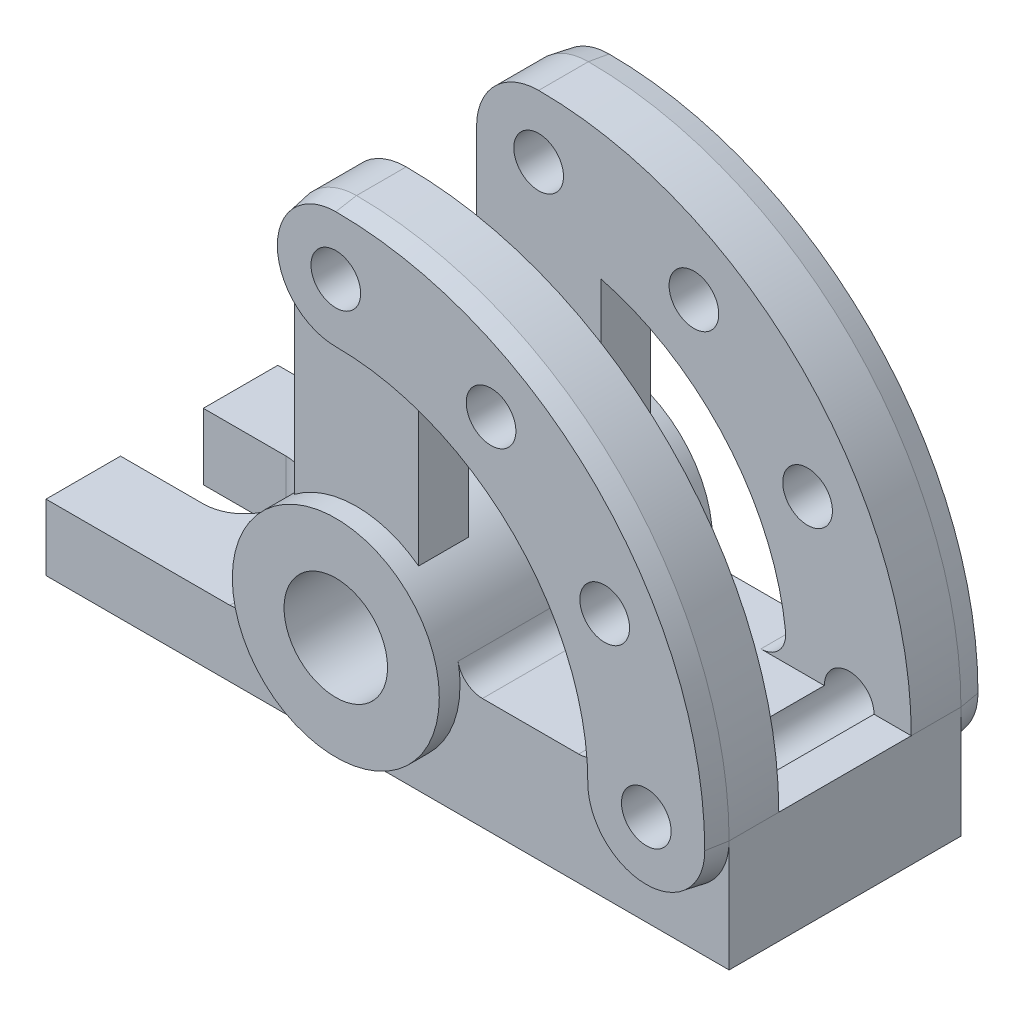
from build123d import *

# Parameters (mm, degrees)
SKETCH1_R                  = 25
BOSS_EXTRUDE1_DEPTH        = 33
CUT_EXTRUDE1_DEPTH         = 49.363209157
CUT_EXTRUDE1_DEPTH_BACK    = 49.363209157
SKETCH2_R                  = 12.5
BOSS_EXTRUDE2_START        = -28
BOSS_EXTRUDE2_DEPTH        = 5
BOSS_EXTRUDE2_DRAFT        = -10
BOSS_EXTRUDE3_START        = -16
BOSS_EXTRUDE3_DEPTH        = 12
BOSS_EXTRUDE5_START        = 28
BOSS_EXTRUDE5_DEPTH        = 5
BOSS_EXTRUDE5_TAPER        = 10
BOSS_EXTRUDE6_START        = 28
BOSS_EXTRUDE6_DEPTH        = 12
BOSS_EXTRUDE7_DEPTH        = 28
F_12_0_12_DIAMETER_HOLE1_D = 12
CIRPATTERN1_COUNT          = 4
CIRPATTERN1_ANGLE          = 90
CUT_EXTRUDE3_DEPTH         = 140.247980237
CUT_EXTRUDE3_DEPTH_BACK    = 56
FILLET1_R                  = 6


with BuildPart() as part:
    # Sketch1 → Boss-Extrude1 (new, symmetric)
    with BuildSketch(Plane.XY):
        Circle(SKETCH1_R)
    extrude(amount=BOSS_EXTRUDE1_DEPTH, both=True)

    # Sketch2 → Cut-Extrude1 (cut, two sides: drawn at the far end of the back side and taken through both)
    with BuildSketch(Plane.XY.offset(-CUT_EXTRUDE1_DEPTH_BACK)):
        Circle(SKETCH2_R)
    extrude(amount=CUT_EXTRUDE1_DEPTH + CUT_EXTRUDE1_DEPTH_BACK, mode=Mode.SUBTRACT)



with BuildPart() as body_2:
    # Sketch4 → Boss-Extrude2 (with draft: the straight prism first)
    with BuildSketch(Plane.XY.offset(BOSS_EXTRUDE2_START)):
        with BuildLine():
            ThreePointArc((90, 0), (63.639610307, 63.639610307), (0, 90))
            ThreePointArc((0, 90), (-15, 75), (0, 60))
            ThreePointArc((0, 60), (42.426406871, 42.426406871), (60, 0))
            ThreePointArc((60, 0), (75, -15), (90, 0))
        make_face()
    extrude(amount=-BOSS_EXTRUDE2_DEPTH)
    # Boss-Extrude2: the draft: its side faces are tilted about the plane it starts from
    boss_extrude2_sides = [body_2.faces().sort_by_distance(p)[0] for p in [
        (42.426406871, 42.426406871, -30.5),
        (75, -15, -30.5),
        (63.639610307, 63.639610307, -30.5),
        (-15, 75, -30.5),
    ]]
    draft(boss_extrude2_sides, Plane.XY.offset(BOSS_EXTRUDE2_START), BOSS_EXTRUDE2_DRAFT)


with BuildPart() as part_1:
    add(part.part)

    add(body_2.part)  # Boss-Extrude3 merges body 2
    # Sketch4<3> → Boss-Extrude3 (add)
    with BuildSketch(Plane.XY.offset(BOSS_EXTRUDE3_START)):
        with BuildLine():
            Line((15, 20), (15, 58.094750193))
            ThreePointArc((15, 58.094750193), (47.434164903, 36.742346142), (60, 0))
            ThreePointArc((60, 0), (75, -15), (90, 0))
            ThreePointArc((90, 0), (63.639610307, 63.639610307), (0, 90))
            ThreePointArc((0, 90), (-10.606601718, 85.606601718), (-15, 75))
            Line((-15, 75), (-15, 20))
            ThreePointArc((-15, 20), (0, 25), (15, 20))
        make_face()
    extrude(amount=-BOSS_EXTRUDE3_DEPTH)



with BuildPart() as body_2_2:
    # Sketch4<5> → Boss-Extrude5 (new body)
    with BuildSketch(Plane.XY.offset(BOSS_EXTRUDE5_START)):
        with BuildLine():
            ThreePointArc((90, 0), (63.639610307, 63.639610307), (0, 90))
            ThreePointArc((0, 90), (-15, 75), (0, 60))
            ThreePointArc((0, 60), (42.426406871, 42.426406871), (60, 0))
            ThreePointArc((60, 0), (75, -15), (90, 0))
        make_face()
    extrude(amount=BOSS_EXTRUDE5_DEPTH, taper=BOSS_EXTRUDE5_TAPER)


with BuildPart() as part_2:
    add(part_1.part)

    add(body_2_2.part)  # Boss-Extrude6 merges body 2 2
    # Sketch4<8> → Boss-Extrude6 (add)
    with BuildSketch(Plane.XY.offset(BOSS_EXTRUDE6_START)):
        with BuildLine():
            ThreePointArc((90, 0), (63.639610307, 63.639610307), (0, 90))
            ThreePointArc((0, 90), (-15, 75), (0, 60))
            ThreePointArc((0, 60), (42.426406871, 42.426406871), (60, 0))
            ThreePointArc((60, 0), (75, -15), (90, 0))
        make_face()
        with BuildLine():
            ThreePointArc((0, 60), (-10.606601718, 64.393398282), (-15, 75))
            Line((-15, 75), (-15, 20))
            ThreePointArc((-15, 20), (0, 25), (15, 20))
            Line((15, 20), (15, 58.094750193))
            ThreePointArc((15, 58.094750193), (7.560257549, 59.521781776), (0, 60))
        make_face()
    extrude(amount=-BOSS_EXTRUDE6_DEPTH)

    # Sketch10 → Boss-Extrude7 (add, symmetric)
    with BuildSketch(Plane.XY):
        with BuildLine():
            Line((-22.449944321, -11), (-75, -11))
            Line((-75, -11), (-75, -27))
            Line((-75, -27), (90, -27))
            Line((90, -27), (90, 0))
            Line((90, 0), (25, 0))
            ThreePointArc((25, 0), (5.645856533, -24.354143467), (-22.449944321, -11))
        make_face()
    extrude(amount=BOSS_EXTRUDE7_DEPTH, both=True)

    # Ø12.0 (12) Diameter Hole1 (through all)
    with Locations(Plane.XY.offset(33)):
        with Locations((0, 75)):
            f_12_0_12_diameter_hole1 = Hole(F_12_0_12_DIAMETER_HOLE1_D / 2)

    # CirPattern1: Ø12.0 (12) Diameter Hole1 ×4 about axis
    cirpattern1_axis = Axis((0, 0, 0), (0, 0, -1))
    for i in range(1, CIRPATTERN1_COUNT):
        add(f_12_0_12_diameter_hole1.rotate(cirpattern1_axis, i * CIRPATTERN1_ANGLE / (CIRPATTERN1_COUNT - 1)), mode=Mode.SUBTRACT)

    # Sketch11 → Cut-Extrude3 (cut, two sides: drawn at the far end of the back side and taken through both)
    with BuildSketch(Plane(origin=(0, -11, 0), x_dir=(1, 0, 0), z_dir=(0, 1, 0)).offset(-CUT_EXTRUDE3_DEPTH_BACK)):
        with BuildLine():
            Line((-55, 10), (-75, 10))
            Line((-75, 10), (-75, -10))
            Line((-75, -10), (-55, -10))
            ThreePointArc((-55, -10), (-45, 0), (-55, 10))
        make_face()
    extrude(amount=CUT_EXTRUDE3_DEPTH + CUT_EXTRUDE3_DEPTH_BACK, mode=Mode.SUBTRACT)

    # Fillet1
    # the kernel refuses this fillet: 6 mm, written as the material it adds along each edge
    with BuildSketch(Plane(origin=(60, 0, -16), x_dir=(-0.055641755903696445, 0.9984507974857616, 0), z_dir=(0, 0, -1))) as fillet1_piece_1:
        with BuildLine():
            CenterArc((6.343160173, -5.990704785), FILLET1_R, 86.810314896, 96.379370208)
            Line((0.352455388, -6.32455532), (0, 0))
            ThreePointArc((0, 0), (3.338505354, 0.092952151), (6.677010708, 0))
        make_face()
    extrude(amount=12)
    with BuildSketch(Plane(origin=(60, 0, 28), x_dir=(-1, 0, 0), z_dir=(0, 0, -1))) as fillet1_piece_2:
        with BuildLine():
            CenterArc((6.33436854, 6), FILLET1_R, 173.620629792, 96.379370208)
            ThreePointArc((0.3715206, 6.666666667), (0.092952151, 3.338505354), (0, 0))
            Line((0, 0), (6.33436854, 0))
        make_face()
    extrude(amount=12)
    with BuildSketch(Plane(origin=(25, 0, 28), x_dir=(-0.09723494563874313, 0.9952614557726179, 0), z_dir=(0, 0, -1))) as fillet1_piece_3:
        with BuildLine():
            CenterArc((5.445156956, 5.971568735), FILLET1_R, 185.579968436, 78.840063128)
            Line((-0.526411779, 5.388159061), (0, 0))
            ThreePointArc((0, 0), (2.430873641, 0.118463606), (4.861747282, 0))
        make_face()
    extrude(amount=56)
    with BuildSketch(Plane(origin=(-22.449944321, -11, 28), x_dir=(-0.30391401052504813, 0.9526994668868987, 0), z_dir=(0, 0, -1))) as fillet1_piece_4:
        with BuildLine():
            CenterArc((8.191325007, -5.935464984), FILLET1_R, 98.411041025, 99.281799087)
            Line((2.475128206, -7.758949048), (0, 0))
            ThreePointArc((0, 0), (3.656841521, -0.268895898), (7.313683042, 0))
        make_face()
    extrude(amount=56)


solid = part_2.part
